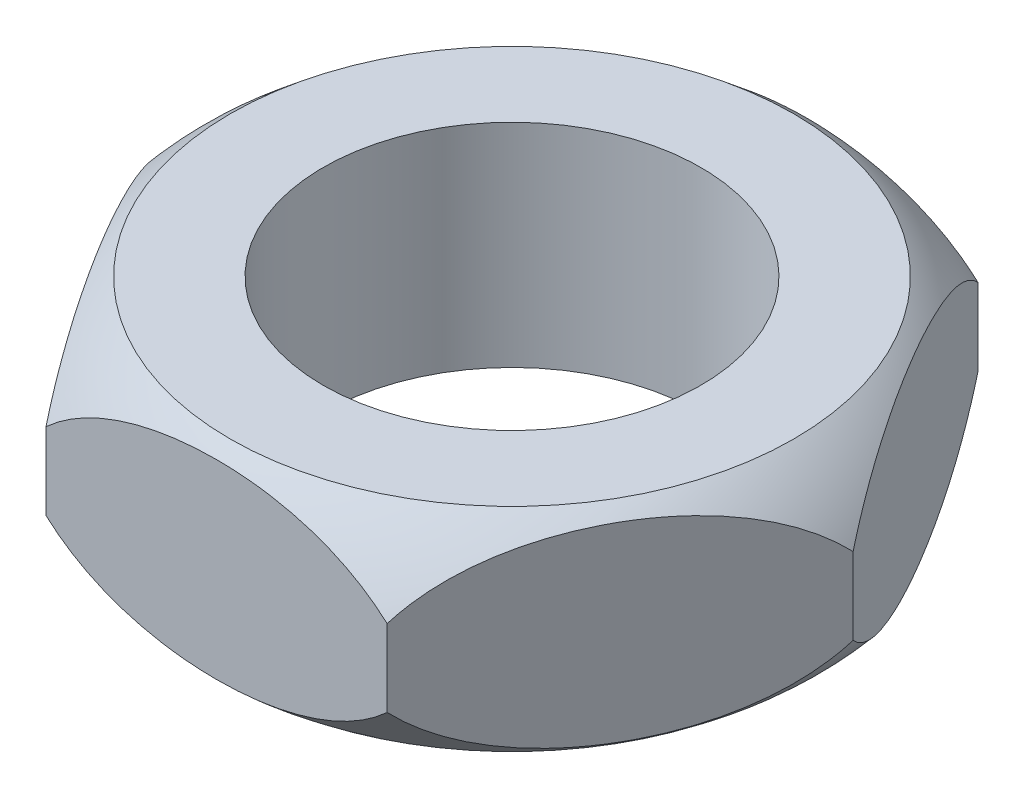
from build123d import *

# Parameters (mm, degrees)
SKETCH1_R           = 7
BOSS_EXTRUDE1_DEPTH = 3.937


# Read off the part's stored shape, not the designer's step: Cut-Revolve-Thin1
with BuildPart() as part:
    # Sketch1 → Boss-Extrude1 (new, symmetric)
    with BuildSketch(Plane(origin=(0, 0, 0), x_dir=(1, 0, 0), z_dir=(0, 1, 0))):
        Polygon((6.324150511, 10.95375), (-6.324150511, 10.95375), (-12.648301022, 0), (-6.324150511, -10.95375), (6.324150511, -10.95375), (12.648301022, 0), align=None)
        with Locations(Location((0, 0, 0), (0, 0, 270))):
            Circle(SKETCH1_R, mode=Mode.SUBTRACT)
    extrude(amount=BOSS_EXTRUDE1_DEPTH, both=True)

    # Cut-Revolve-Thin1 outline → Cut-Revolve-Thin1 (revolve, cut)
    with BuildSketch(Plane.XY):
        with BuildLine():
            ThreePointArc((12.648306093, -1.426964265), (11.685557296, -2.803541534), (10.44575, -3.937))
            Line((10.44575, -3.937), (12.648306093, -3.937))
            Line((12.648306093, -3.937), (12.648306093, -1.426964265))
        make_face()
        with BuildLine():
            ThreePointArc((10.44575, 3.937), (11.685557296, 2.803541534), (12.648306093, 1.426964265))
            Line((12.648306093, 1.426964265), (12.648306093, 3.937))
            Line((12.648306093, 3.937), (10.44575, 3.937))
        make_face()
    revolve(axis=Axis((0, 0, 0), (0, 1, 0)), mode=Mode.SUBTRACT)


solid = part.part
